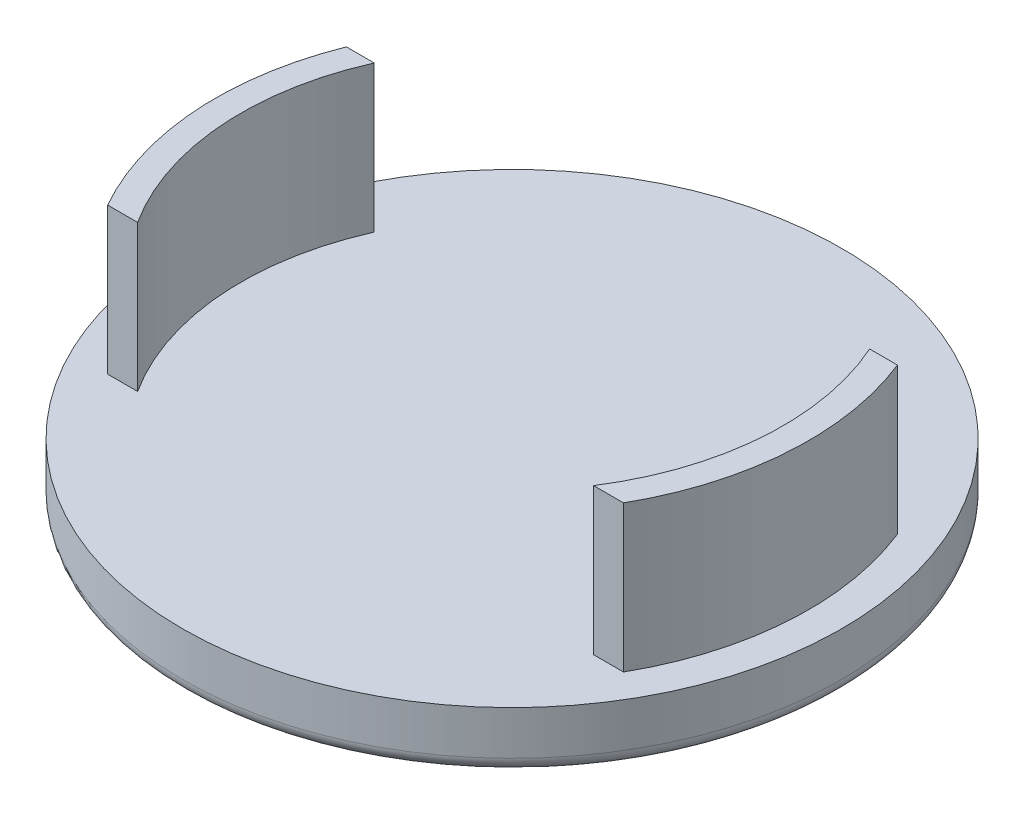
from build123d import *

# Parameters (mm, degrees)
SKETCH1_R           = 22.5
BOSS_EXTRUDE1_DEPTH = 4
SKETCH2_R           = 20.25
SKETCH2_R_2         = 18.5
BOSS_EXTRUDE2_DEPTH = 10
SKETCH3_W           = 46.515228405
SKETCH3_H           = 15.633520553
SKETCH3_W_2         = 41.010467647
SKETCH3_H_2         = 11.670092807
CUT_EXTRUDE1_DEPTH  = 10
FILLET1_R           = 1


with BuildPart() as part:
    # Sketch1 → Boss-Extrude1 (new body)
    with BuildSketch(Plane(origin=(0, 0, 0), x_dir=(1, 0, 0), z_dir=(0, 1, 0))):
        Circle(SKETCH1_R)
    extrude(amount=BOSS_EXTRUDE1_DEPTH)

    # Sketch2 → Boss-Extrude2 (add)
    with BuildSketch(Plane(origin=(0, 4, 0), x_dir=(1, 0, 0), z_dir=(0, 1, 0))):
        Circle(SKETCH2_R)
        Circle(SKETCH2_R_2, mode=Mode.SUBTRACT)
    extrude(amount=BOSS_EXTRUDE2_DEPTH)

    # Sketch3 → Cut-Extrude1 (cut)
    with BuildSketch(Plane(origin=(0, 14, 0), x_dir=(1, 0, 0), z_dir=(0, 1, 0))):
        with Locations((-0.927501078, 15.316760277)):
            Rectangle(SKETCH3_W, SKETCH3_H)
        with Locations((-0.707310647, -15.835046403)):
            Rectangle(SKETCH3_W_2, SKETCH3_H_2)
    extrude(amount=-CUT_EXTRUDE1_DEPTH, mode=Mode.SUBTRACT)

    # Fillet1
    fillet1_edges = [part.edges().sort_by_distance(p)[0] for p in [
        (-22.5, 0, 0),
    ]]
    fillet(fillet1_edges, radius=FILLET1_R)


solid = part.part
